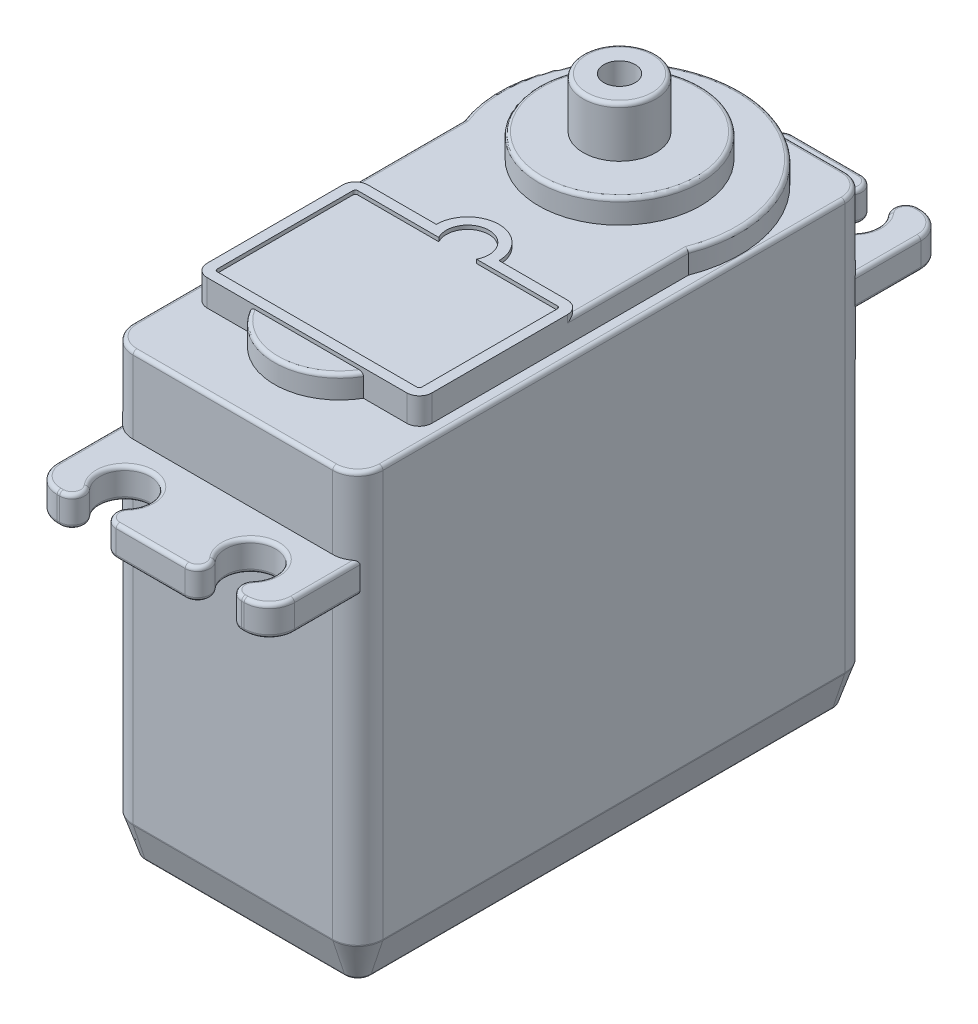
from build123d import *
from build123d.topology import SkipClean

# Parameters (mm, degrees)
EXTRUSION1_DEPTH          = 2.4
EXTRUSION2_DEPTH          = 8.5
EXTRUSION2_DEPTH_BACK     = 27.2
EXTRUSION3_DEPTH          = 1.8
EXTRUSION4_DEPTH          = 0.3
ESQUISSE5_R               = 6.45
EXTRUSION5_DEPTH          = 1.9
ESQUISSE7_R               = 2.9
EXTRUSION6_DEPTH          = 4
TROU_TARAUD_M3X0_51_D     = 2.5
TROU_TARAUD_M3X0_51_DEPTH = 8
TROU_TARAUD_M3X0_51_TIP   = 0.751075774
CHANFREIN1_SIZE           = 1
CHANFREIN1_SIZE2          = 3
CONG_5_R                  = 0.3


with BuildPart() as part:
    # Esquisse1 → Extrusion1 (new body)
    with BuildSketch(Plane(origin=(0, 0, 0), x_dir=(1, 0, 0), z_dir=(0, 1, 0))):
        with BuildLine():
            Line((-2.75, 16.55), (2.75, 16.55))
            ThreePointArc((2.75, 16.55), (3.647952389, 15.971796541), (3.493150685, 14.915068493))
            ThreePointArc((3.493150685, 14.915068493), (5, 11.6), (6.506849315, 14.915068493))
            ThreePointArc((6.506849315, 14.915068493), (6.352047611, 15.971796541), (7.25, 16.55))
            Line((7.25, 16.55), (7.45, 16.55))
            ThreePointArc((7.45, 16.55), (8.864213562, 15.964213562), (9.45, 14.55))
            Line((9.45, 14.55), (9.45, 9.322875656))
            ThreePointArc((9.45, 9.322875656), (9.820828693, 8.707106781), (9.95, 8))
            Line((9.95, 8), (9.95, -28.8))
            ThreePointArc((9.95, -28.8), (9.820828693, -29.507106781), (9.45, -30.122875656))
            Line((9.45, -30.122875656), (9.45, -35.35))
            ThreePointArc((9.45, -35.35), (8.864213562, -36.764213562), (7.45, -37.35))
            Line((7.45, -37.35), (7.25, -37.35))
            ThreePointArc((7.25, -37.35), (6.352047611, -36.771796541), (6.506849315, -35.715068493))
            ThreePointArc((6.506849315, -35.715068493), (5, -32.4), (3.493150685, -35.715068493))
            ThreePointArc((3.493150685, -35.715068493), (3.647952389, -36.771796541), (2.75, -37.35))
            Line((2.75, -37.35), (-2.75, -37.35))
            ThreePointArc((-2.75, -37.35), (-3.647952389, -36.771796541), (-3.493150685, -35.715068493))
            ThreePointArc((-3.493150685, -35.715068493), (-5, -32.4), (-6.506849315, -35.715068493))
            ThreePointArc((-6.506849315, -35.715068493), (-6.352047611, -36.771796541), (-7.25, -37.35))
            Line((-7.25, -37.35), (-7.45, -37.35))
            ThreePointArc((-7.45, -37.35), (-8.864213562, -36.764213562), (-9.45, -35.35))
            Line((-9.45, -35.35), (-9.45, -30.122875656))
            ThreePointArc((-9.45, -30.122875656), (-9.820828693, -29.507106781), (-9.95, -28.8))
            Line((-9.95, -28.8), (-9.95, 8))
            ThreePointArc((-9.95, 8), (-9.820828693, 8.707106781), (-9.45, 9.322875656))
            Line((-9.45, 9.322875656), (-9.45, 14.55))
            ThreePointArc((-9.45, 14.55), (-8.864213562, 15.964213562), (-7.45, 16.55))
            Line((-7.45, 16.55), (-7.25, 16.55))
            ThreePointArc((-7.25, 16.55), (-6.352047611, 15.971796541), (-6.506849315, 14.915068493))
            ThreePointArc((-6.506849315, 14.915068493), (-5, 11.6), (-3.493150685, 14.915068493))
            ThreePointArc((-3.493150685, 14.915068493), (-3.647952389, 15.971796541), (-2.75, 16.55))
        make_face()
    extrude(amount=EXTRUSION1_DEPTH)

    # Esquisse2 → Extrusion2 (add, two sides: drawn at the far end of the back side and taken through both)
    with SkipClean():  # the faces are left unmerged after this step: merging them gives an invalid solid
        with BuildSketch(Plane(origin=(0, 0, 0), x_dir=(1, 0, 0), z_dir=(0, 1, 0)).offset(-EXTRUSION2_DEPTH_BACK)):
            with BuildLine():
                Line((9.95, -28.8), (9.95, 8))
                ThreePointArc((9.95, 8), (9.364213562, 9.414213562), (7.95, 10))
                Line((7.95, 10), (-7.95, 10))
                ThreePointArc((-7.95, 10), (-9.364213562, 9.414213562), (-9.95, 8))
                Line((-9.95, 8), (-9.95, -28.8))
                ThreePointArc((-9.95, -28.8), (-9.364213562, -30.214213562), (-7.95, -30.8))
                Line((-7.95, -30.8), (7.95, -30.8))
                ThreePointArc((7.95, -30.8), (9.364213562, -30.214213562), (9.95, -28.8))
            make_face()
        extrude(amount=EXTRUSION2_DEPTH + EXTRUSION2_DEPTH_BACK)
    add(part.part.scale(1), mode=Mode.REPLACE)  # the faces are merged on a copy

    # Esquisse3 → Extrusion3 (add)
    with BuildSketch(Plane(origin=(0, 8.5, 0), x_dir=(1, 0, 0), z_dir=(0, 1, 0))):
        with BuildLine():
            Line((8.95, -3.472391107), (8.95, -23.9))
            ThreePointArc((8.95, -23.9), (8.657106781, -24.607106781), (7.95, -24.9))
            Line((7.95, -24.9), (4.5, -24.9))
            ThreePointArc((4.5, -24.9), (0, -27.494237156), (-4.5, -24.9))
            Line((-4.5, -24.9), (-7.95, -24.9))
            ThreePointArc((-7.95, -24.9), (-8.657106781, -24.607106781), (-8.95, -23.9))
            Line((-8.95, -23.9), (-8.95, -3.472391107))
            ThreePointArc((-8.95, -3.472391107), (0, 9.6), (8.95, -3.472391107))
        make_face()
    extrude(amount=EXTRUSION3_DEPTH)

    # Esquisse4 → Extrusion4 (add)
    with BuildSketch(Plane(origin=(0, 10.3, 0), x_dir=(1, 0, 0), z_dir=(0, 1, 0))):
        with BuildLine():
            Line((7.95, -24.9), (-7.95, -24.9))
            ThreePointArc((-7.95, -24.9), (-8.657106781, -24.607106781), (-8.95, -23.9))
            Line((-8.95, -23.9), (-8.95, -13.1))
            ThreePointArc((-8.95, -13.1), (-8.657106781, -12.392893219), (-7.95, -12.1))
            Line((-7.95, -12.1), (-2.5, -12.1))
            ThreePointArc((-2.5, -12.1), (0, -9.6), (2.5, -12.1))
            Line((2.5, -12.1), (7.95, -12.1))
            ThreePointArc((7.95, -12.1), (8.657106781, -12.392893219), (8.95, -13.1))
            Line((8.95, -13.1), (8.95, -23.9))
            ThreePointArc((8.95, -23.9), (8.657106781, -24.607106781), (7.95, -24.9))
        make_face()
        with BuildLine():
            Line((7.95, -24.1), (-7.95, -24.1))
            ThreePointArc((-7.95, -24.1), (-8.091421356, -24.041421356), (-8.15, -23.9))
            Line((-8.15, -23.9), (-8.15, -13.1))
            ThreePointArc((-8.15, -13.1), (-8.091421356, -12.958578644), (-7.95, -12.9))
            Line((-7.95, -12.9), (-1.5, -12.9))
            ThreePointArc((-1.5, -12.9), (0, -10.4), (1.5, -12.9))
            Line((1.5, -12.9), (7.95, -12.9))
            ThreePointArc((7.95, -12.9), (8.091421356, -12.958578644), (8.15, -13.1))
            Line((8.15, -13.1), (8.15, -23.9))
            ThreePointArc((8.15, -23.9), (8.091421356, -24.041421356), (7.95, -24.1))
        make_face(mode=Mode.SUBTRACT)
    extrude(amount=EXTRUSION4_DEPTH)

    # Esquisse5 → Extrusion5 (add)
    with BuildSketch(Plane(origin=(0, 10.3, 0), x_dir=(1, 0, 0), z_dir=(0, 1, 0))):
        with Locations(Location((0, 0, 0), (0, 0, 90))):
            Circle(ESQUISSE5_R)
    extrude(amount=EXTRUSION5_DEPTH)

    # Esquisse7 → Extrusion6 (add)
    with BuildSketch(Plane(origin=(0, 12.2, 0), x_dir=(-1, 0, 0), z_dir=(0, 1, 0))):
        with Locations(Location((0, 0, 0), (0, 0, 90))):
            Circle(ESQUISSE7_R)
    extrude(amount=EXTRUSION6_DEPTH)

    # Trou taraudé M3x0.51
    with Locations(Plane(origin=(0, 16.2, 0), x_dir=(-1, 0, 0), z_dir=(0, 1, 0))):
        with Locations((0, 0)):
            Hole(TROU_TARAUD_M3X0_51_D / 2, depth=TROU_TARAUD_M3X0_51_DEPTH)
            with Locations((0, 0, -(TROU_TARAUD_M3X0_51_DEPTH + TROU_TARAUD_M3X0_51_TIP / 2))):  # 118° drill point
                Cone(0, TROU_TARAUD_M3X0_51_D / 2, TROU_TARAUD_M3X0_51_TIP, mode=Mode.SUBTRACT)

    # Chanfrein1
    chanfrein1_edges = [part.edges().sort_by_distance(p)[0] for p in [
        (9.364213562, -27.2, 30.214213562),
        (0, -27.2, 30.8),
        (-9.364213562, -27.2, 30.214213562),
        (-9.95, -27.2, 10.4),
        (-9.364213562, -27.2, -9.414213562),
        (0, -27.2, -10),
        (9.364213562, -27.2, -9.414213562),
        (9.95, -27.2, 10.4),
    ]]
    chanfrein1_side = [part.faces().sort_by_distance(p)[0] for p in [
        (0, -27.2, 10.4),
    ]]
    chamfer(chanfrein1_edges, length=CHANFREIN1_SIZE, length2=CHANFREIN1_SIZE2, reference=chanfrein1_side[0])

    # Congé5
    cong_5_edges = [part.edges().sort_by_distance(p)[0] for p in [
        (-9.364213562, -24.2, -9.414213562),
        (-9.364213562, 8.5, -9.414213562),
        (0, -24.2, -10),
        (-8.657106781, -27.2, -8.707106781),
        (-8.864213562, 0, -15.964213562),
        (-9.45, 0, -11.936437828),
        (9.45, 0, -11.936437828),
        (8.864213562, 0, -15.964213562),
        (7.35, 0, -16.55),
        (6.352047611, 0, -15.971796541),
        (5, 0, -11.6),
        (3.647952389, 0, -15.971796541),
        (0, 0, -16.55),
        (-3.647952389, 0, -15.971796541),
        (-5, 0, -11.6),
        (-6.352047611, 0, -15.971796541),
        (-7.35, 0, -16.55),
        (-9.95, -24.2, 10.4),
        (-9.95, 8.5, 10.4),
        (-9.45, 2.4, -11.936437828),
        (9.95, 8.5, 10.4),
        (9.364213562, 8.5, 30.214213562),
        (9.364213562, 8.5, -9.414213562),
        (0, 8.5, 30.8),
        (0, 8.5, -10),
        (-9.364213562, 8.5, 30.214213562),
        (-8.864213562, 2.4, -15.964213562),
        (9.45, 2.4, -11.936437828),
        (8.864213562, 2.4, -15.964213562),
        (7.35, 2.4, -16.55),
        (6.352047611, 2.4, -15.971796541),
        (5, 2.4, -11.6),
        (3.647952389, 2.4, -15.971796541),
        (0, 2.4, -16.55),
        (-3.647952389, 2.4, -15.971796541),
        (-5, 2.4, -11.6),
        (-6.352047611, 2.4, -15.971796541),
        (-7.35, 2.4, -16.55),
        (9.364213562, -24.2, -9.414213562),
        (0, -27.2, -9),
        (8.657106781, -27.2, 29.507106781),
        (0, -27.2, 29.8),
        (8.95, -27.2, 10.4),
        (-8.657106781, -27.2, 29.507106781),
        (8.657106781, -27.2, -8.707106781),
        (-8.95, -27.2, 10.4),
        (-9.364213562, -24.2, 30.214213562),
        (9.95, -24.2, 10.4),
        (9.364213562, -24.2, 30.214213562),
        (0, 10.3, -9.6),
        (-8.95, 10.3, 8.286195554),
        (0, 10.3, 27.494237156),
        (8.95, 10.3, 8.286195554),
        (0, -24.2, 30.8),
        (-9.45, 0, 32.736437828),
        (-8.864213562, 0, 36.764213562),
        (-7.35, 0, 37.35),
        (-6.352047611, 0, 36.771796541),
        (-5, 0, 32.4),
        (-3.647952389, 0, 36.771796541),
        (0, 0, 37.35),
        (3.647952389, 0, 36.771796541),
        (5, 0, 32.4),
        (6.352047611, 0, 36.771796541),
        (7.35, 0, 37.35),
        (8.864213562, 0, 36.764213562),
        (9.45, 0, 32.736437828),
        (-9.45, 2.4, 32.736437828),
        (-8.864213562, 2.4, 36.764213562),
        (-7.35, 2.4, 37.35),
        (-6.352047611, 2.4, 36.771796541),
        (-5, 2.4, 32.4),
        (-3.647952389, 2.4, 36.771796541),
        (0, 2.4, 37.35),
        (3.647952389, 2.4, 36.771796541),
        (5, 2.4, 32.4),
        (6.352047611, 2.4, 36.771796541),
        (7.35, 2.4, 37.35),
        (8.864213562, 2.4, 36.764213562),
        (9.45, 2.4, 32.736437828),
        (0, 12.2, 6.45),
        (0, 16.2, -2.9),
    ]]
    fillet(cong_5_edges, radius=CONG_5_R)


solid = part.part
